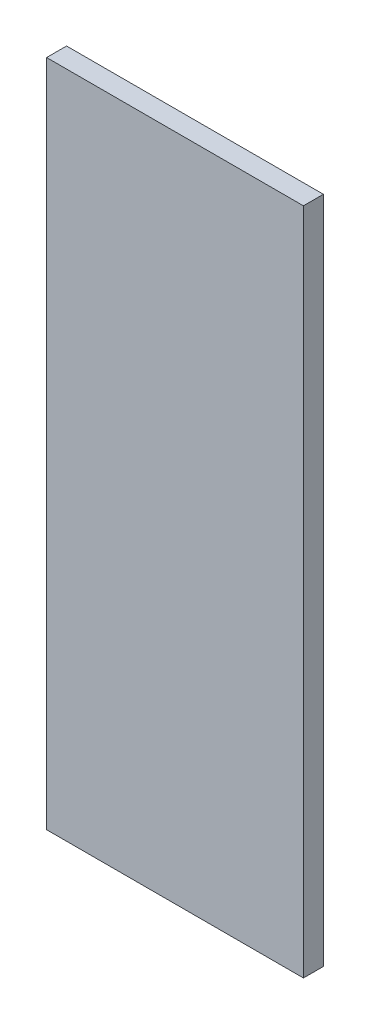
from build123d import *

# Parameters (mm, degrees)
SKETCH1_W           = 245.05
SKETCH1_H           = 638.1
BOSS_EXTRUDE1_DEPTH = 19.05


with BuildPart() as part:
    # Sketch1 → Boss-Extrude1 (new body)
    with BuildSketch(Plane.XY):
        with Locations((-122.525, -319.05)):
            Rectangle(SKETCH1_W, SKETCH1_H)
    extrude(amount=BOSS_EXTRUDE1_DEPTH)


solid = part.part
